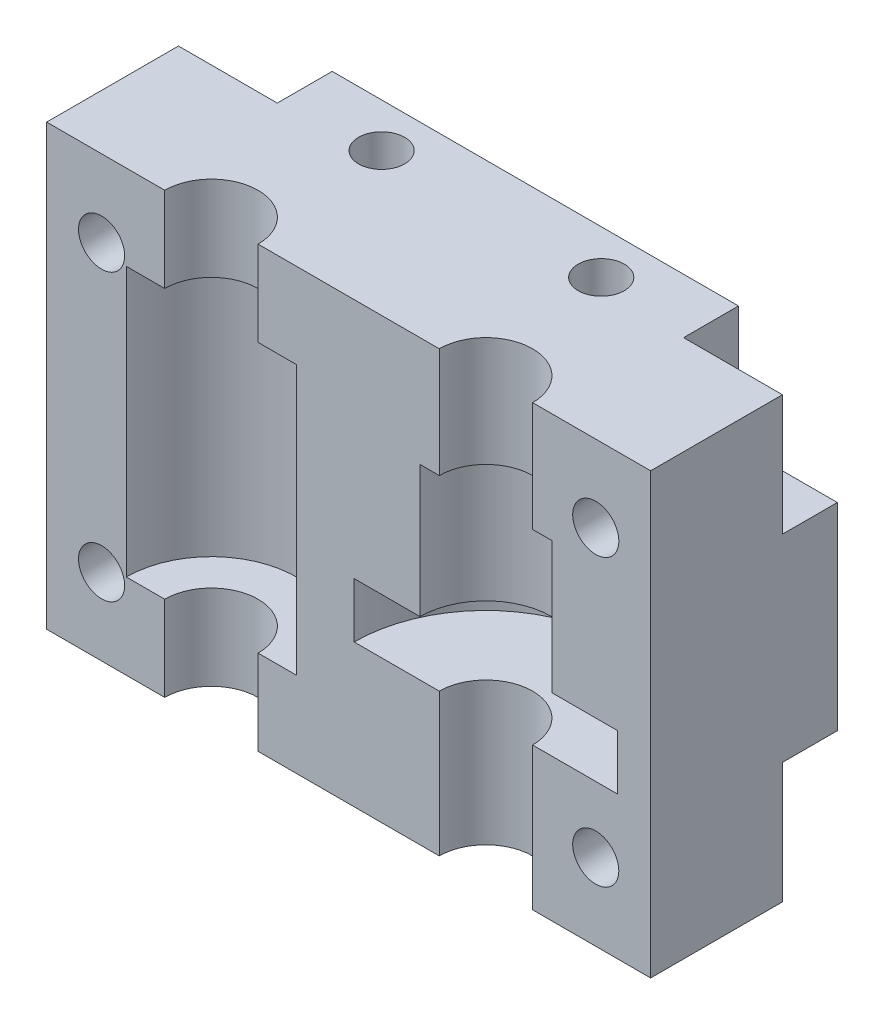
from build123d import *
from build123d.topology import SkipClean

# Parameters (mm, degrees)
ESQUISSE1_W                  = 55
ESQUISSE1_H                  = 45
BOSS_EXTRU_1_DEPTH           = 12
ESQUISSE2_R                  = 4.25
ENL_V_MAT_EXTRU_1_DEPTH      = 55.085580333
ENL_V_MAT_EXTRU_2_DEPTH      = 12.25
ENL_V_MAT_EXTRU_2_DEPTH_BACK = 12.25
ESQUISSE3_R                  = 7.75
ESQUISSE9_W                  = 61.062756781
ESQUISSE9_H                  = 12.22812859
ESQUISSE9_W_2                = 59.427147224
ESQUISSE9_H_2                = 8.100161614
ENL_V_MAT_EXTRU_7_DEPTH      = 31
SKETCH1_W                    = 55
SKETCH1_H                    = 36
BOSS_EXTRUDE1_DEPTH          = 5
SKETCH2_R                    = 2.1
CUT_EXTRUDE1_DEPTH           = 38.003378224
SKETCH3_R                    = 4
CUT_EXTRUDE2_DEPTH           = 10
CUT_EXTRUDE3_DEPTH           = 5
SKETCH5_R                    = 2.1
CUT_EXTRUDE4_DEPTH           = 10
BOSS_EXTRUDE4_START          = 2
SKETCH7_R                    = 2.1
BOSS_EXTRUDE4_DEPTH          = 2
SKETCH8_R                    = 2.1
BOSS_EXTRUDE5_DEPTH          = 2
SKETCH9_W                    = 7
SKETCH9_H                    = 3.2
CUT_EXTRUDE6_DEPTH           = 8
ESQUISSE12_R                 = 6
ENL_V_MAT_EXTRU_9_DEPTH      = 12
ESQUISSE13_R                 = 12
ENL_V_MAT_EXTRU_10_DEPTH     = 5


with BuildPart() as part:
    # Esquisse1 → Boss.-Extru.1 (new body)
    with BuildSketch(Plane.XY):
        Rectangle(ESQUISSE1_W, ESQUISSE1_H)
    extrude(amount=BOSS_EXTRU_1_DEPTH)

    # Esquisse2 → Enlèv. mat.-Extru.1 (cut, through all)
    with BuildSketch(Plane(origin=(0, 22.5, 0), x_dir=(1, 0, 0), z_dir=(0, 1, 0))):
        with Locations((-12.5, -12)):
            Circle(ESQUISSE2_R)
        with Locations((12.5, -12)):
            Circle(ESQUISSE2_R)
    extrude(amount=-ENL_V_MAT_EXTRU_1_DEPTH, mode=Mode.SUBTRACT)

    # Esquisse3 → Enlèv. mat.-Extru.2 (cut, two sides: drawn at the far end of the back side and taken through both)
    with BuildSketch(Plane(origin=(0, 0, 0), x_dir=(1, 0, 0), z_dir=(0, 1, 0)).offset(-ENL_V_MAT_EXTRU_2_DEPTH_BACK)):
        with Locations((-12.5, -12)):
            Circle(ESQUISSE3_R)
    extrude(amount=ENL_V_MAT_EXTRU_2_DEPTH + ENL_V_MAT_EXTRU_2_DEPTH_BACK, mode=Mode.SUBTRACT)

    # Esquisse9 → Enlèv. mat.-Extru.7 (cut)
    with BuildSketch(Plane.XY.offset(12)):
        with Locations((-0.389430846, -24.114064295)):
            Rectangle(ESQUISSE9_W, ESQUISSE9_H)
        with Locations((1.674552641, 22.050080807)):
            Rectangle(ESQUISSE9_W_2, ESQUISSE9_H_2)
    extrude(amount=-ENL_V_MAT_EXTRU_7_DEPTH, mode=Mode.SUBTRACT)

    # Sketch1 → Boss-Extrude1 (add)
    with BuildSketch(Plane(origin=(0, 0, 0), x_dir=(-1, 0, 0), z_dir=(0, 0, -1))):
        Rectangle(SKETCH1_W, SKETCH1_H)
    extrude(amount=BOSS_EXTRUDE1_DEPTH)

    # Sketch2 → Cut-Extrude1 (cut, through all)
    with BuildSketch(Plane.XY.offset(12)):
        with Locations((-22.5, 13)):
            Circle(SKETCH2_R)
        with Locations((22.5, 13)):
            Circle(SKETCH2_R)
        with Locations((22.5, -13)):
            Circle(SKETCH2_R)
        with Locations((-22.5, -13)):
            Circle(SKETCH2_R)
    extrude(amount=-CUT_EXTRUDE1_DEPTH, mode=Mode.SUBTRACT)

    # Sketch3 → Cut-Extrude2 (cut)
    with BuildSketch(Plane(origin=(0, 0, -5), x_dir=(-1, 0, 0), z_dir=(0, 0, -1))):
        with Locations((-22.5, 13)):
            Circle(SKETCH3_R)
        with Locations((22.5, 13)):
            Circle(SKETCH3_R)
        with Locations((22.5, -13)):
            Circle(SKETCH3_R)
        with Locations((-22.5, -13)):
            Circle(SKETCH3_R)
    extrude(amount=-CUT_EXTRUDE2_DEPTH, mode=Mode.SUBTRACT)

    # Sketch4 → Cut-Extrude3 (cut)
    with BuildSketch(Plane(origin=(0, 0, -5), x_dir=(-1, 0, 0), z_dir=(0, 0, -1))):
        with BuildLine():
            Line((-18.5, 13), (-18.5, 18))
            Line((-18.5, 18), (-27.5, 18))
            Line((-27.5, 18), (-27.5, 9))
            Line((-27.5, 9), (-22.5, 9))
            ThreePointArc((-22.5, 9), (-25.328427125, 15.828427125), (-18.5, 13))
        make_face()
        with BuildLine():
            Line((-22.5, -9), (-27.5, -9))
            Line((-27.5, -9), (-27.5, -18))
            Line((-27.5, -18), (-18.5, -18))
            Line((-18.5, -18), (-18.5, -13))
            ThreePointArc((-18.5, -13), (-25.328427125, -15.828427125), (-22.5, -9))
        make_face()
        with BuildLine():
            Line((27.5, -18), (27.5, -9))
            Line((27.5, -9), (22.5, -9))
            ThreePointArc((22.5, -9), (25.328427125, -15.828427125), (18.5, -13))
            Line((18.5, -13), (18.5, -18))
            Line((18.5, -18), (27.5, -18))
        make_face()
        with BuildLine():
            Line((27.5, 18), (18.5, 18))
            Line((18.5, 18), (18.5, 13))
            ThreePointArc((18.5, 13), (25.328427125, 15.828427125), (22.5, 9))
            Line((22.5, 9), (27.5, 9))
            Line((27.5, 9), (27.5, 18))
        make_face()
    extrude(amount=-CUT_EXTRUDE3_DEPTH, mode=Mode.SUBTRACT)

    # Sketch5 → Cut-Extrude4 (cut)
    with BuildSketch(Plane(origin=(0, 18, 0), x_dir=(1, 0, 0), z_dir=(0, 1, 0))):
        with Locations((-10, 1)):
            Circle(SKETCH5_R)
        with Locations((10, 1)):
            Circle(SKETCH5_R)
    extrude(amount=-CUT_EXTRUDE4_DEPTH, mode=Mode.SUBTRACT)

    # Sketch7 → Boss-Extrude4 (add)
    with SkipClean():  # the faces are left unmerged after this step: merging them gives an invalid solid
        with BuildSketch(Plane(origin=(0, 18, 0), x_dir=(1, 0, 0), z_dir=(0, 1, 0)).offset(BOSS_EXTRUDE4_START)):
            with BuildLine():
                Line((18.5, 5), (-18.5, 5))
                Line((-18.5, 5), (-18.5, 0))
                Line((-18.5, 0), (-27.5, 0))
                Line((-27.5, 0), (-27.5, -12))
                Line((-27.5, -12), (-16.75, -12))
                ThreePointArc((-16.75, -12), (-12.5, -7.75), (-8.25, -12))
                Line((-8.25, -12), (8.25, -12))
                ThreePointArc((8.25, -12), (12.5, -7.75), (16.75, -12))
                Line((16.75, -12), (27.5, -12))
                Line((27.5, -12), (27.5, 0))
                Line((27.5, 0), (18.5, 0))
                Line((18.5, 0), (18.5, 5))
            make_face()
            with Locations((10, 1)):
                Circle(SKETCH7_R, mode=Mode.SUBTRACT)
            with Locations((-10, 1)):
                Circle(SKETCH7_R, mode=Mode.SUBTRACT)
        extrude(amount=-BOSS_EXTRUDE4_DEPTH)
    add(part.part.scale(1), mode=Mode.REPLACE)  # the faces are merged on a copy

    # Sketch8 → Boss-Extrude5 (add)
    with BuildSketch(Plane.XZ.offset(18)):
        with BuildLine():
            Line((-27.5, 0), (-18.5, 0))
            Line((-18.5, 0), (-18.5, -5))
            Line((-18.5, -5), (18.5, -5))
            Line((18.5, -5), (18.5, 0))
            Line((18.5, 0), (27.5, 0))
            Line((27.5, 0), (27.5, 12))
            Line((27.5, 12), (16.75, 12))
            ThreePointArc((16.75, 12), (12.5, 7.75), (8.25, 12))
            Line((8.25, 12), (-8.25, 12))
            ThreePointArc((-8.25, 12), (-12.5, 7.75), (-16.75, 12))
            Line((-16.75, 12), (-27.5, 12))
            Line((-27.5, 12), (-27.5, 0))
        make_face()
        with Locations((10, -1)):
            Circle(SKETCH8_R, mode=Mode.SUBTRACT)
        with Locations((-10, -1)):
            Circle(SKETCH8_R, mode=Mode.SUBTRACT)
    extrude(amount=BOSS_EXTRUDE5_DEPTH)

    # Sketch9 → Cut-Extrude6 (cut)
    with BuildSketch(Plane(origin=(0, 0, -5), x_dir=(-1, 0, 0), z_dir=(0, 0, -1))):
        with Locations((-10, 14.4)):
            Rectangle(SKETCH9_W, SKETCH9_H)
        with Locations((10, 14.4)):
            Rectangle(SKETCH9_W, SKETCH9_H)
        with Locations((10, -14.4)):
            Rectangle(SKETCH9_W, SKETCH9_H)
        with Locations((-10, -14.4)):
            Rectangle(SKETCH9_W, SKETCH9_H)
    extrude(amount=-CUT_EXTRUDE6_DEPTH, mode=Mode.SUBTRACT)

    # Esquisse12 → Enlèv. mat.-Extru.9 (cut)
    with BuildSketch(Plane(origin=(0, -2, 0), x_dir=(1, 0, 0), z_dir=(0, 1, 0))):
        with Locations((12.5, -12)):
            Circle(ESQUISSE12_R)
    extrude(amount=ENL_V_MAT_EXTRU_9_DEPTH, mode=Mode.SUBTRACT)

    # Esquisse13 → Enlèv. mat.-Extru.10 (cut)
    with BuildSketch(Plane(origin=(0, -2, 0), x_dir=(1, 0, 0), z_dir=(0, 1, 0))):
        with Locations((12.5, -12)):
            Circle(ESQUISSE13_R)
    extrude(amount=-ENL_V_MAT_EXTRU_10_DEPTH, mode=Mode.SUBTRACT)


solid = part.part
